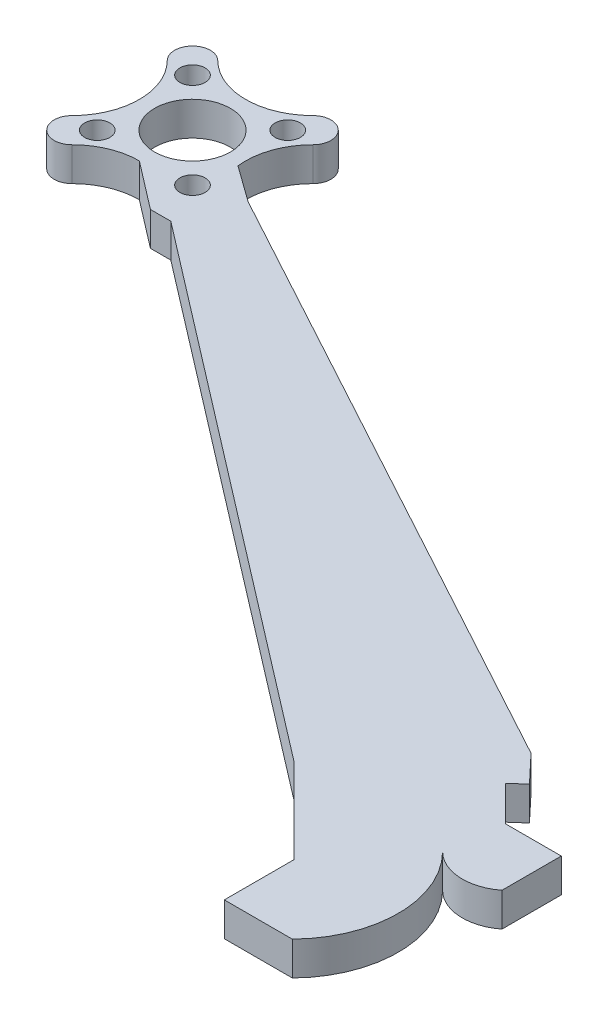
from build123d import *

# Parameters (mm, degrees)
SKETCH1_W            = 16.31
SKETCH1_H            = 16.31
SKETCH1_R            = 4.5
BOSS_EXTRUDE1_DEPTH  = 4
SKETCH3_R            = 1.5
CUT_EXTRUDE1_DEPTH   = 4
BOSS_EXTRUDE2_DEPTH  = 4
BOSS_EXTRUDE6_DEPTH  = 4
CUT_EXTRUDE3_DEPTH   = 4
BOSS_EXTRUDE7_DEPTH  = 4
BOSS_EXTRUDE9_DEPTH  = 4
SKETCH17_OUTSIDE_W   = 136.165
SKETCH17_OUTSIDE_H   = 117.232
CUT_EXTRUDE4_DEPTH   = 4
SKETCH18_R           = 1.5
BOSS_EXTRUDE10_DEPTH = 4
CUT_EXTRUDE5_DEPTH   = 4


with BuildPart() as part:
    # Sketch1 → Boss-Extrude1 (new body)
    with BuildSketch(Plane(origin=(0, 0, 0), x_dir=(1, 0, 0), z_dir=(0, 1, 0))):
        Rectangle(SKETCH1_W, SKETCH1_H)
        Circle(SKETCH1_R, mode=Mode.SUBTRACT)
    extrude(amount=BOSS_EXTRUDE1_DEPTH)

    # Sketch3 → Cut-Extrude1 (cut)
    with BuildSketch(Plane(origin=(0, 4, 0), x_dir=(1, 0, 0), z_dir=(0, 1, 0))):
        with Locations((5.656854249, 5.656854249)):
            Circle(SKETCH3_R)
        with Locations((5.656854249, -5.656854249)):
            Circle(SKETCH3_R)
        with Locations((-5.656854249, -5.656854249)):
            Circle(SKETCH3_R)
        with Locations((-5.656854249, 5.656854249)):
            Circle(SKETCH3_R)
    extrude(amount=-CUT_EXTRUDE1_DEPTH, mode=Mode.SUBTRACT)

    # Sketch4 → Boss-Extrude2 (add)
    with BuildSketch(Plane(origin=(0, 4, 0), x_dir=(1, 0, 0), z_dir=(0, 1, 0))):
        Polygon((8.155, -8.155), (0, -8.155), (0, -10.655), (10.655, -10.655), (10.655, 0), (8.155, 0), align=None)
    extrude(amount=-BOSS_EXTRUDE2_DEPTH)

    # Sketch9 → Boss-Extrude6 (add)
    with BuildSketch(Plane(origin=(0, 4, 0), x_dir=(1, 0, 0), z_dir=(0, 1, 0))):
        Polygon((71.061407011, -58.982568069), (7.593139788, -10.281653748), (10.613791504, -4.032054751), (84.193483815, -43.982568069), (90.501950314, -50.291034568), (96.061407011, -50.291034568), (96.061407011, -73.982568069), (81.061407011, -73.982568069), (81.061407011, -68.982568069), align=None)
    extrude(amount=-BOSS_EXTRUDE6_DEPTH)

    # Sketch12 → Cut-Extrude3 (cut)
    with BuildSketch(Plane(origin=(0, 4, 0), x_dir=(1, 0, 0), z_dir=(0, 1, 0))):
        Polygon((87.278639473, -47.258318902), (85.780514725, -48.583317861), (89.960889469, -52.761034568), (90.501950314, -52.761034568), (96.061407011, -52.761034568), (96.061407011, -50.291034568), (90.501950314, -50.291034568), (87.347717064, -47.136801318), align=None)
    extrude(amount=-CUT_EXTRUDE3_DEPTH, mode=Mode.SUBTRACT)

    # Sketch13 → Boss-Extrude7 (add)
    with BuildSketch(Plane(origin=(0, 4, 0), x_dir=(1, 0, 0), z_dir=(0, 1, 0))):
        Polygon((81.061407011, -73.982568069), (81.061407011, -77.282568069), (96.561407011, -77.282568069), (96.561407011, -52.761034568), (96.061407011, -52.761034568), (96.061407011, -73.982568069), align=None)
    extrude(amount=-BOSS_EXTRUDE7_DEPTH)

    # Sketch16 → Boss-Extrude9 (add)
    with BuildSketch(Plane(origin=(0, 4, 0), x_dir=(1, 0, 0), z_dir=(0, 1, 0))):
        Polygon((0, -10.655), (-10, -10.655), (-10, 10.345), (10.655, 10.345), (10.655, 0), (8.155, 0), (8.155, 8.155), (-8.155, 8.155), (-8.155, -8.155), (0, -8.155), align=None)
    extrude(amount=-BOSS_EXTRUDE9_DEPTH)

    # Sketch17 outside → Cut-Extrude4 (cut)
    with BuildSketch(Plane(origin=(0, 4, 0), x_dir=(1, 0, 0), z_dir=(0, 1, 0))):
        with Locations((43.2805, -33.469)):
            Rectangle(SKETCH17_OUTSIDE_W, SKETCH17_OUTSIDE_H)
        with BuildLine():
            Line((5.656854249, -8.656854249), (5.656854249, -10.655))
            Line((5.656854249, -10.655), (8.079694096, -10.655))
            Line((8.079694096, -10.655), (71.061407011, -58.982568069))
            Line((71.061407011, -58.982568069), (81.061407011, -68.982568069))
            Line((81.061407011, -68.982568069), (81.061407011, -77.282568069))
            Line((81.061407011, -77.282568069), (96.561407011, -77.282568069))
            Line((96.561407011, -77.282568069), (96.561407011, -52.761034568))
            Line((96.561407011, -52.761034568), (89.960889469, -52.761034568))
            Line((89.960889469, -52.761034568), (85.780514725, -48.583317861))
            Line((85.780514725, -48.583317861), (87.278639473, -47.258318902))
            Line((87.278639473, -47.258318902), (84.193483815, -43.982568069))
            Line((84.193483815, -43.982568069), (10.655, -4.054429139))
            Line((10.655, -4.054429139), (8.656854249, -5.656854249))
            ThreePointArc((8.656854249, -5.656854249), (6.313708499, 0), (8.656854249, 5.656854249))
            ThreePointArc((8.656854249, 5.656854249), (8.656854249, 8.656854249), (5.656854249, 8.656854249))
            ThreePointArc((5.656854249, 8.656854249), (0, 6.313708499), (-5.656854249, 8.656854249))
            ThreePointArc((-5.656854249, 8.656854249), (-8.656854249, 8.656854249), (-8.656854249, 5.656854249))
            ThreePointArc((-8.656854249, 5.656854249), (-6.313708499, 0), (-8.656854249, -5.656854249))
            ThreePointArc((-8.656854249, -5.656854249), (-8.656854249, -8.656854249), (-5.656854249, -8.656854249))
            ThreePointArc((-5.656854249, -8.656854249), (0, -6.313708499), (5.656854249, -8.656854249))
        make_face(mode=Mode.SUBTRACT)
    extrude(amount=-CUT_EXTRUDE4_DEPTH, mode=Mode.SUBTRACT)

    # Sketch18 → Boss-Extrude10 (add)
    with BuildSketch(Plane(origin=(0, 4, 0), x_dir=(1, 0, 0), z_dir=(0, 1, 0))):
        Polygon((5.656854249, -10.655), (0, -6.313708499), (6.372805828, -0.97060021), (10.655, -4.054429139), (8.656854249, -5.656854249), align=None)
        with Locations((5.656854249, -5.656854249)):
            Circle(SKETCH18_R, mode=Mode.SUBTRACT)
    extrude(amount=-BOSS_EXTRUDE10_DEPTH)

    # Sketch19 → Cut-Extrude5 (cut)
    with BuildSketch(Plane(origin=(0, 4, 0), x_dir=(1, 0, 0), z_dir=(0, 1, 0))):
        with BuildLine():
            Line((97.061407011, -77.355955856), (97.061407011, -59.355955856))
            ThreePointArc((97.061407011, -59.355955856), (93.061407011, -61.012810105), (89.061407011, -59.355955856))
            ThreePointArc((89.061407011, -59.355955856), (92.789329073, -68.355955856), (89.061407011, -77.355955856))
            Line((89.061407011, -77.355955856), (97.061407011, -77.355955856))
        make_face()
    extrude(amount=-CUT_EXTRUDE5_DEPTH, mode=Mode.SUBTRACT)


solid = part.part
